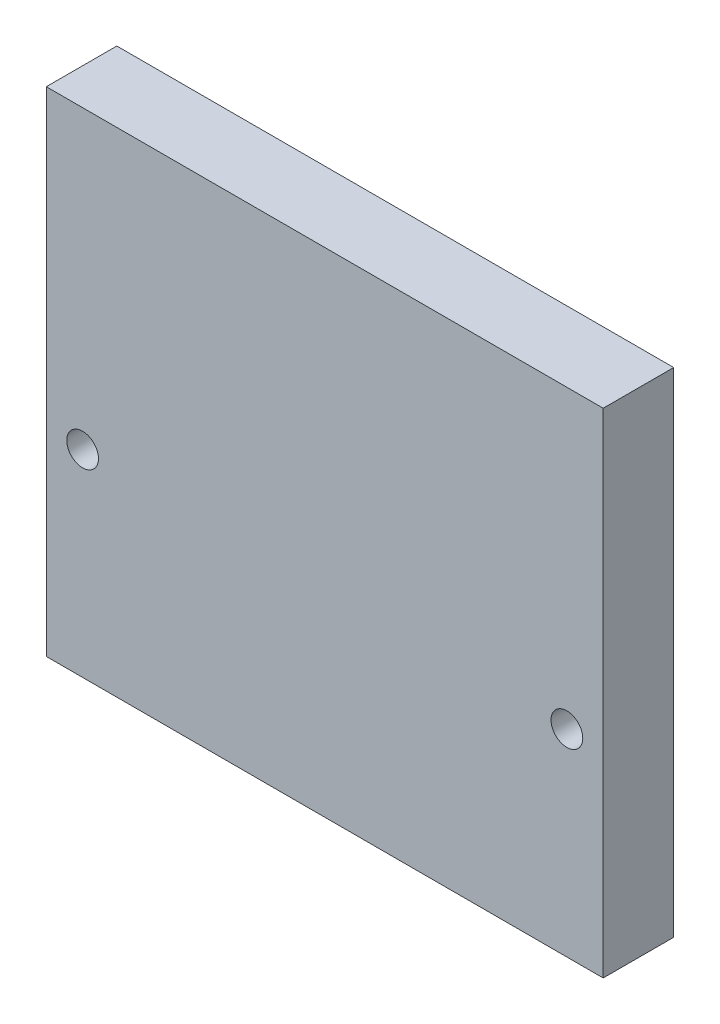
from build123d import *

# Parameters (mm, degrees)
SKETCH1_W            = 79
SKETCH1_H            = 70
BOSS_EXTRUDE1_DEPTH  = 10
M4_CLEARANCE_HOLE1_D = 4.5
CUT_EXTRUDE3_DEPTH   = 3.5


with BuildPart() as part:
    # Sketch1 → Boss-Extrude1 (new body)
    with BuildSketch(Plane.XY):
        with Locations((39.5, 35)):
            Rectangle(SKETCH1_W, SKETCH1_H)
    extrude(amount=BOSS_EXTRUDE1_DEPTH)

    # M4 Clearance Hole1 (through all)
    with Locations(Plane.XY.offset(10)):
        with Locations((5.15, 28), (73.85, 28)):
            Hole(M4_CLEARANCE_HOLE1_D / 2)

    # Sketch11 → Cut-Extrude3 (cut)
    with BuildSketch(Plane(origin=(0, 0, 0), x_dir=(-1, 0, 0), z_dir=(0, 0, -1))):
        Polygon((-69.635343035, 28), (-71.742671517, 31.65), (-75.957328483, 31.65), (-78.064656965, 28), (-75.957328483, 24.35), (-71.742671517, 24.35), align=None)
        Polygon((-9.364656965, 28), (-7.257328483, 24.35), (-3.042671517, 24.35), (-0.935343035, 28), (-3.042671517, 31.65), (-7.257328483, 31.65), align=None)
    extrude(amount=-CUT_EXTRUDE3_DEPTH, mode=Mode.SUBTRACT)


solid = part.part
